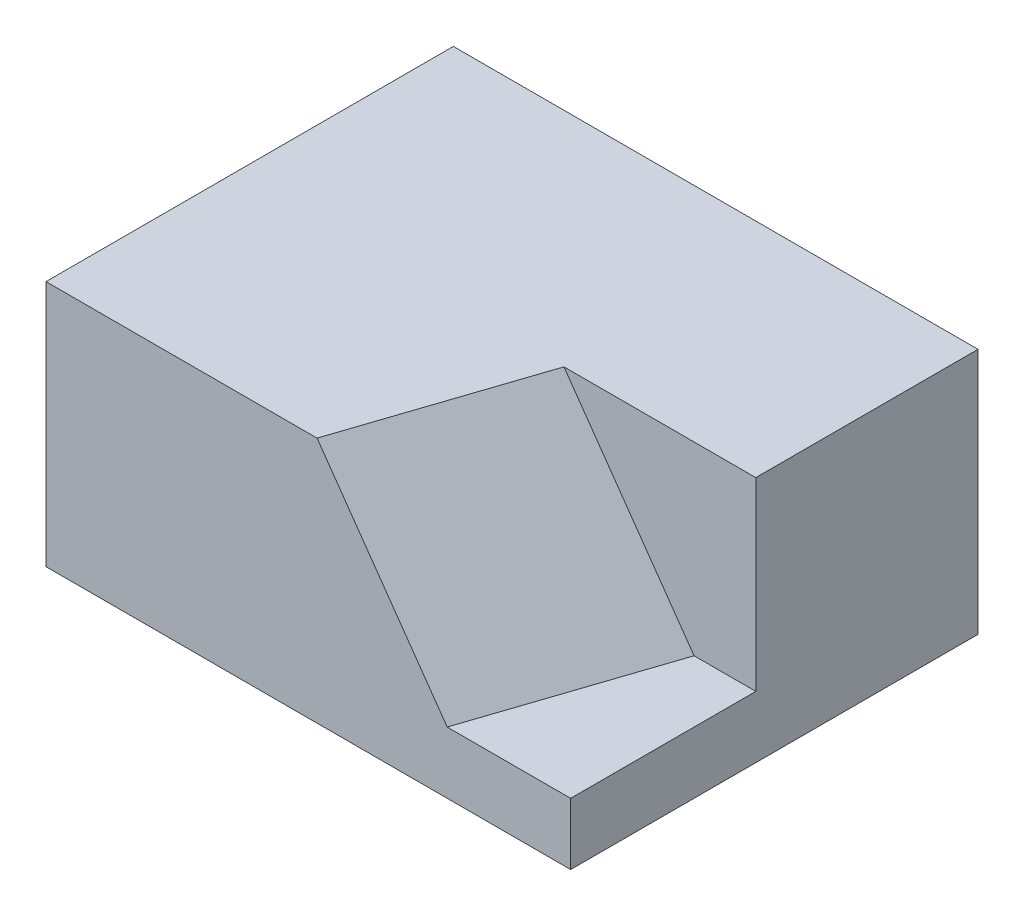
from build123d import *

# Parameters (mm, degrees)
SKETCH1_W               = 85
SKETCH1_H               = 66
BOSS_EXTRUDE1_DEPTH     = 40
CUT_EXTRUDE1_DEPTH      = 115.808536268
CUT_EXTRUDE1_DEPTH_BACK = 30
CHAMFER1_SIZE2          = 20
CHAMFER1_SIZE           = 30


with BuildPart() as part:
    # Sketch1 → Boss-Extrude1 (new body)
    with BuildSketch(Plane(origin=(0, 0, 0), x_dir=(1, 0, 0), z_dir=(0, 1, 0))):
        with Locations((42.5, 33)):
            Rectangle(SKETCH1_W, SKETCH1_H)
    extrude(amount=BOSS_EXTRUDE1_DEPTH)

    # Sketch3 → Cut-Extrude1 (cut, two sides: drawn at the far end of the back side and taken through both)
    with BuildSketch(Plane(origin=(0, 40, 0), x_dir=(1, 0, 0), z_dir=(0, 1, 0)).offset(-CUT_EXTRUDE1_DEPTH_BACK)):
        Polygon((280.267374354, 30), (85, 30), (75, 30), (65, 0), (3.251034432, -185.246896704), (242.87031101, -493.629763025), (519.886650932, -278.382866321), align=None)
    extrude(amount=CUT_EXTRUDE1_DEPTH + CUT_EXTRUDE1_DEPTH_BACK, mode=Mode.SUBTRACT)

    # Chamfer1
    chamfer1_edges = [part.edges().sort_by_distance(p)[0] for p in [
        (70, 40, -15),
    ]]
    chamfer1_side = [part.faces().sort_by_distance(p)[0] for p in [
        (70, 39.6, -15),
    ]]
    chamfer(chamfer1_edges, length=CHAMFER1_SIZE - 0.0001, length2=CHAMFER1_SIZE2 - 0.0001, reference=chamfer1_side[0])  # a hair under: the kernel refuses the full size


solid = part.part
